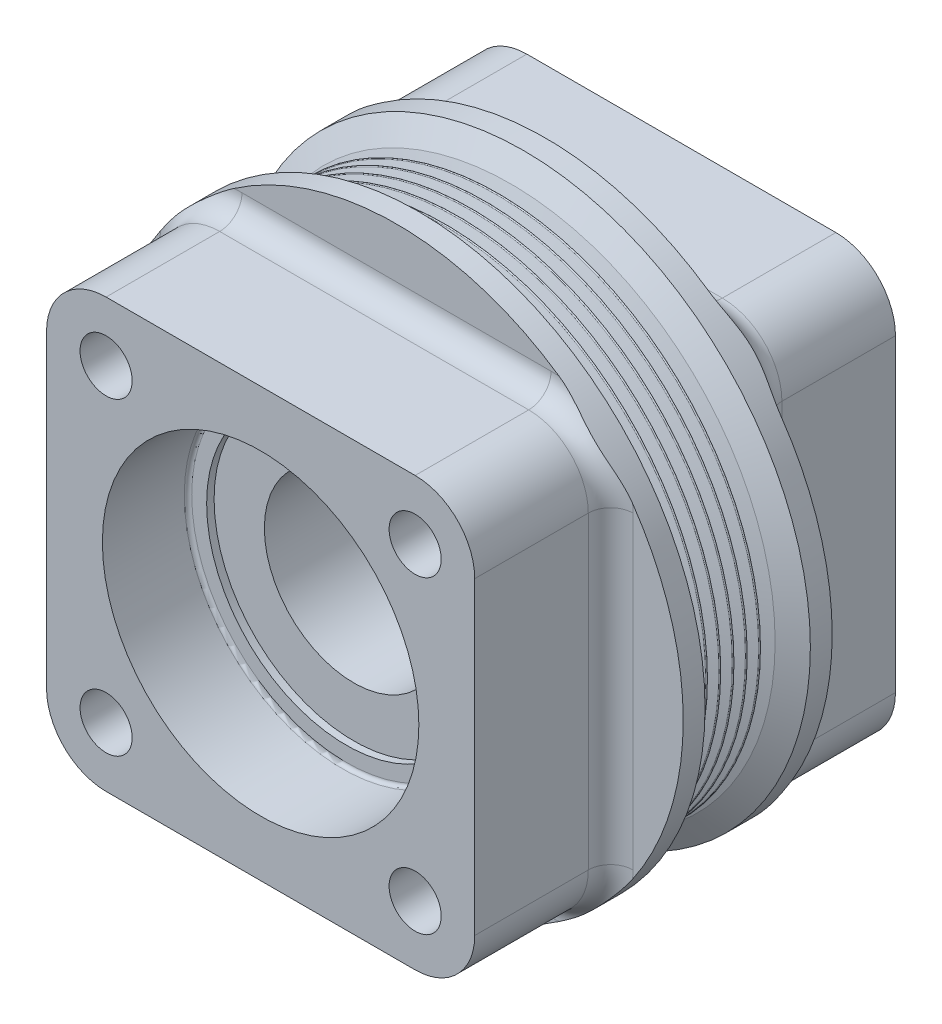
from build123d import *

# Parameters (mm, degrees)
EXTRUS_O_QUADRADO_DEPTH       = 56.5
FURO_EIXO_PASSANTE_DEPTH      = 123.6794605090844
FURO_EIXO_PASSANTE_DEPTH_BACK = 123.6794605090844
ESBO_O4_5_R                   = 24
REBAIXO_START                 = -56.5
ESBO_O4_R                     = 42.5
REBAIXO_ROLAMENTO_1_DEPTH     = 23
REBAIXO_START_2               = 33.5
ESBO_O4_4_R                   = 42.5
REBAIXO_ROLAMENTO_2_DEPTH     = 23
CORTE_EXTRUS_O4_START         = 33.5
ESBO_O4_6_R                   = 37.50000000000001
CORTE_EXTRUS_O4_DEPTH         = 2
CORTE_EXTRUS_O5_START         = -31.5
ESBO_O4_7_R                   = 37.50000000000001
CORTE_EXTRUS_O5_DEPTH         = 2
FUROS_FIXA_O_1_D              = 14
FUROS_FIXA_O_1_DEPTH          = 30
FUROS_FIXA_O_1_TIP            = 4.206024333192922
FUROS_FIXA_O_2_D              = 14
FUROS_FIXA_O_2_DEPTH          = 30
FUROS_FIXA_O_2_TIP            = 4.206024333192922
FILETE_AL_VIO_R               = 6
FILETE4_R                     = 1


# Read off the part's stored shape, not the designer's step: CORTE REVOLUÇÃO POLIA
with BuildPart() as part:
    # Esboço2 → EXTRUSÃO QUADRADO (new, symmetric)
    with BuildSketch(Plane.XY):
        with BuildLine():
            Line((-41.49999999999999, -57.5), (41.50000000000001, -57.5))
            ThreePointArc((41.50000000000001, -57.5), (52.81370849898477, -52.81370849898476), (57.5, -41.5))
            Line((57.5, -41.5), (57.50000000000001, 41.500000000000014))
            ThreePointArc((57.50000000000001, 41.500000000000014), (52.813708498984774, 52.81370849898478), (41.50000000000001, 57.500000000000014))
            Line((41.50000000000001, 57.500000000000014), (-41.49999999999999, 57.500000000000014))
            ThreePointArc((-41.49999999999999, 57.500000000000014), (-52.81370849898475, 52.813708498984774), (-57.49999999999999, 41.500000000000014))
            Line((-57.49999999999999, 41.500000000000014), (-57.49999999999999, -41.5))
            ThreePointArc((-57.49999999999999, -41.5), (-52.81370849898475, -52.81370849898476), (-41.49999999999999, -57.5))
        make_face()
    extrude(amount=EXTRUS_O_QUADRADO_DEPTH, both=True)

    # Esboço3 → REVOLUÇÃO POLIA (revolve)
    with BuildSketch(Plane(origin=(0, 0, 0), x_dir=(0, 0, -1), z_dir=(1, 0, 0)), mode=Mode.PRIVATE) as revolu_o_polia_sk:
        with BuildLine():
            Line((-7.354923155196484, 70.35455393579063), (-8.430153689607168, 67.40038232178915))
            ThreePointArc((-8.430153689607168, 67.40038232178915), (-8.900000000000023, 67.07139239345206), (-9.369846310392886, 67.40038232178915))
            Line((-9.369846310392886, 67.40038232178915), (-10.679999999999998, 71))
            Line((-10.679999999999998, 71), (-14.144101615137766, 77))
            Line((-14.144101615137766, 77), (-20.000000000000004, 77))
            Line((-20.000000000000004, 77), (-20, 0))
            Line((-20, 0), (20, 0))
            Line((20, 0), (20.000000000000004, 77))
            Line((20.000000000000004, 77), (14.144101615137759, 77))
            Line((14.144101615137759, 77), (10.679999999999998, 71))
            Line((10.679999999999998, 71), (9.369846310392832, 67.40038232178915))
            ThreePointArc((9.369846310392832, 67.40038232178915), (8.89999999999998, 67.07139239345206), (8.43015368960713, 67.40038232178915))
            Line((8.43015368960713, 67.40038232178915), (7.354923155196457, 70.35455393579065))
            ThreePointArc((7.354923155196457, 70.35455393579065), (7.119999999999998, 70.51904889995923), (6.885076844803523, 70.35455393579066))
            Line((6.885076844803523, 70.35455393579066), (5.809846310392832, 67.40038232178917))
            ThreePointArc((5.809846310392832, 67.40038232178917), (5.339999999999984, 67.07139239345206), (4.8701536896071085, 67.40038232178915))
            Line((4.8701536896071085, 67.40038232178915), (3.7949231551964493, 70.35455393579062))
            ThreePointArc((3.7949231551964493, 70.35455393579062), (3.559999999999979, 70.51904889995919), (3.325076844803502, 70.35455393579062))
            Line((3.325076844803502, 70.35455393579062), (2.249846310392827, 67.40038232178917))
            ThreePointArc((2.249846310392827, 67.40038232178917), (1.7799999999999798, 67.07139239345207), (1.310153689607125, 67.40038232178917))
            Line((1.310153689607125, 67.40038232178917), (0.23492315519646462, 70.35455393579063))
            ThreePointArc((0.23492315519646462, 70.35455393579063), (3.83e-15, 70.51904889995922), (-0.23492315519647558, 70.35455393579065))
            Line((-0.23492315519647558, 70.35455393579065), (-1.3101536896071617, 67.40038232178917))
            ThreePointArc((-1.3101536896071617, 67.40038232178917), (-1.7800000000000142, 67.07139239345206), (-2.2498463103928654, 67.40038232178917))
            Line((-2.2498463103928654, 67.40038232178917), (-3.325076844803528, 70.35455393579063))
            ThreePointArc((-3.325076844803528, 70.35455393579063), (-3.560000000000005, 70.51904889995922), (-3.7949231551964853, 70.35455393579063))
            Line((-3.7949231551964853, 70.35455393579063), (-4.870153689607166, 67.40038232178915))
            ThreePointArc((-4.870153689607166, 67.40038232178915), (-5.340000000000018, 67.07139239345206), (-5.809846310392879, 67.40038232178915))
            Line((-5.809846310392879, 67.40038232178915), (-6.885076844803537, 70.35455393579062))
            ThreePointArc((-6.885076844803537, 70.35455393579062), (-7.12, 70.5190488999592), (-7.354923155196484, 70.35455393579063))
        make_face()
    revolve(revolu_o_polia_sk.sketch.rotate(Axis((0, 0, 20), (0, 0, -1)), 90), axis=Axis((0, 0, 20), (0, 0, -1)))

    # CORTE REVOLUÇÃO POLIA outline → CORTE REVOLUÇÃO POLIA (revolve, cut)
    with BuildSketch(Plane.XZ):
        with BuildLine():
            Line((77, 14.144101615), (71, 10.68))
            Line((71, 10.68), (67.400382322, 9.36984631))
            ThreePointArc((67.400382322, 9.36984631), (67.071392393, 8.9), (67.400382322, 8.43015369))
            Line((67.400382322, 8.43015369), (70.354553936, 7.354923155))
            ThreePointArc((70.354553936, 7.354923155), (70.5190489, 7.12), (70.354553936, 6.885076845))
            Line((70.354553936, 6.885076845), (67.400382322, 5.80984631))
            ThreePointArc((67.400382322, 5.80984631), (67.071392393, 5.34), (67.400382322, 4.87015369))
            Line((67.400382322, 4.87015369), (70.354553936, 3.794923155))
            ThreePointArc((70.354553936, 3.794923155), (70.5190489, 3.56), (70.354553936, 3.325076845))
            Line((70.354553936, 3.325076845), (67.400382322, 2.24984631))
            ThreePointArc((67.400382322, 2.24984631), (67.071392393, 1.78), (67.400382322, 1.31015369))
            Line((67.400382322, 1.31015369), (70.354553936, 0.234923155))
            ThreePointArc((70.354553936, 0.234923155), (70.5190489, 0), (70.354553936, -0.234923155))
            Line((70.354553936, -0.234923155), (67.400382322, -1.31015369))
            ThreePointArc((67.400382322, -1.31015369), (67.071392393, -1.78), (67.400382322, -2.24984631))
            Line((67.400382322, -2.24984631), (70.354553936, -3.325076845))
            ThreePointArc((70.354553936, -3.325076845), (70.5190489, -3.56), (70.354553936, -3.794923155))
            Line((70.354553936, -3.794923155), (67.400382322, -4.87015369))
            ThreePointArc((67.400382322, -4.87015369), (67.071392393, -5.34), (67.400382322, -5.80984631))
            Line((67.400382322, -5.80984631), (70.354553936, -6.885076845))
            ThreePointArc((70.354553936, -6.885076845), (70.5190489, -7.12), (70.354553936, -7.354923155))
            Line((70.354553936, -7.354923155), (67.400382322, -8.43015369))
            ThreePointArc((67.400382322, -8.43015369), (67.071392393, -8.9), (67.400382322, -9.36984631))
            Line((67.400382322, -9.36984631), (71, -10.68))
            Line((71, -10.68), (77, -14.144101615))
            Line((77, -14.144101615), (77, 14.144101615))
        make_face()
    revolve(axis=Axis((0, 0, 0), (0, 0, 1)), mode=Mode.SUBTRACT)

    # Esboço4<5> → FURO EIXO PASSANTE (cut, two sides: drawn at the far end of the back side and taken through both)
    with BuildSketch(Plane.XY.offset(-FURO_EIXO_PASSANTE_DEPTH_BACK)):
        Circle(ESBO_O4_5_R)
    extrude(amount=FURO_EIXO_PASSANTE_DEPTH + FURO_EIXO_PASSANTE_DEPTH_BACK, mode=Mode.SUBTRACT)

    # Esboço4 → REBAIXO ROLAMENTO 1 (cut)
    with BuildSketch(Plane.XY.offset(REBAIXO_START)):
        with Locations(Location((0, 0, 0), (0, 0, 180))):
            Circle(ESBO_O4_R)
    extrude(amount=REBAIXO_ROLAMENTO_1_DEPTH, mode=Mode.SUBTRACT)

    # Esboço4<4> → REBAIXO ROLAMENTO 2 (cut)
    with BuildSketch(Plane.XY.offset(REBAIXO_START_2)):
        with Locations(Location((0, 0, 0), (0, 0, 180))):
            Circle(ESBO_O4_4_R)
    extrude(amount=REBAIXO_ROLAMENTO_2_DEPTH, mode=Mode.SUBTRACT)

    # Esboço4<6> → Corte-extrusão4 (cut)
    with BuildSketch(Plane.XY.offset(CORTE_EXTRUS_O4_START)):
        with Locations(Location((0, 0, 0), (0, 0, 180))):
            Circle(ESBO_O4_6_R)
    extrude(amount=-CORTE_EXTRUS_O4_DEPTH, mode=Mode.SUBTRACT)

    # Esboço4<7> → Corte-extrusão5 (cut)
    with BuildSketch(Plane.XY.offset(CORTE_EXTRUS_O5_START)):
        with Locations(Location((0, 0, 0), (0, 0, 180))):
            Circle(ESBO_O4_7_R)
    extrude(amount=-CORTE_EXTRUS_O5_DEPTH, mode=Mode.SUBTRACT)

    # FUROS FIXAÇÃO 1
    with Locations(Plane(origin=(0, 0, -56.5), x_dir=(-1, 0, 0), z_dir=(0, 0, -1))):
        with Locations((41.5, 41.5), (-41.5, -41.5), (-41.5, 41.5), (41.5, -41.5)):
            Hole(FUROS_FIXA_O_1_D / 2, depth=FUROS_FIXA_O_1_DEPTH)
            with Locations((0, 0, -(FUROS_FIXA_O_1_DEPTH + FUROS_FIXA_O_1_TIP / 2))):  # 118° drill point
                Cone(0, FUROS_FIXA_O_1_D / 2, FUROS_FIXA_O_1_TIP, mode=Mode.SUBTRACT)

    # FUROS FIXAÇÃO 2
    with Locations(Plane.XY.offset(56.5)):
        with Locations((-41.5, 41.5), (41.5, 41.5), (41.5, -41.5), (-41.5, -41.5)):
            Hole(FUROS_FIXA_O_2_D / 2, depth=FUROS_FIXA_O_2_DEPTH)
            with Locations((0, 0, -(FUROS_FIXA_O_2_DEPTH + FUROS_FIXA_O_2_TIP / 2))):  # 118° drill point
                Cone(0, FUROS_FIXA_O_2_D / 2, FUROS_FIXA_O_2_TIP, mode=Mode.SUBTRACT)

    # FILETE ALÍVIO
    # the kernel refuses this fillet: 6 mm, written as the material it adds along each edge
    with BuildSketch(Plane(origin=(-41.499999999999986, 41.500000000000014, 20.000000000000004), x_dir=(-4.4e-16, 1, 0), z_dir=(1, 4.4e-16, 0))) as filete_al_vio_piece_1_section:
        with BuildLine():
            CenterArc((16 + FILETE_AL_VIO_R, FILETE_AL_VIO_R), FILETE_AL_VIO_R, 180, 90)
            Line((16 + FILETE_AL_VIO_R, 0), (16, 0))
            Line((16, 0), (16, FILETE_AL_VIO_R))
        make_face()
    filete_al_vio_piece_1 = revolve(axis=Axis((-41.499999999999986, 41.500000000000014, 20.000000000000004), (0, 0, 1)), revolution_arc=89.99999999999997, mode=Mode.PRIVATE)
    filete_al_vio_piece_1 = filete_al_vio_piece_1 & Plane(origin=(0, 0, 21.714468670196165), x_dir=(1, 1.1e-16, 0), z_dir=(0, 0, 1)) * Cylinder(77, 88, mode=Mode.PRIVATE)
    add(filete_al_vio_piece_1)
    with BuildSketch(Plane(origin=(-57.49999999999999, 41.500000000000014, 20.000000000000004), x_dir=(0, 0, 1), z_dir=(0, -1, 0)), Plane(origin=(-57.49999999999999, -41.5, -20), x_dir=(0, 0, -1), z_dir=(0, 1, 0)), Plane(origin=(57.5, -41.5, 20.000000000000004), x_dir=(0, 0, 1), z_dir=(9e-17, 1, 0))) as filete_al_vio_piece_2:
        with BuildLine():
            CenterArc((FILETE_AL_VIO_R, FILETE_AL_VIO_R), FILETE_AL_VIO_R, 180, 90)
            Line((0, FILETE_AL_VIO_R), (0, 0))
            Line((0, 0), (FILETE_AL_VIO_R, 0))
        make_face()
    extrude(amount=83.00000000000001)
    with BuildSketch(Plane(origin=(-41.499999999999986, -41.5, 20.000000000000004), x_dir=(-1, 0, 0), z_dir=(0, 1, 0))) as filete_al_vio_piece_3_section:
        with BuildLine():
            CenterArc((16 + FILETE_AL_VIO_R, FILETE_AL_VIO_R), FILETE_AL_VIO_R, 180, 90)
            Line((16 + FILETE_AL_VIO_R, 0), (16, 0))
            Line((16, 0), (16, FILETE_AL_VIO_R))
        make_face()
    filete_al_vio_piece_3 = revolve(axis=Axis((-41.499999999999986, -41.5, 20.000000000000004), (0, 0, 1)), revolution_arc=89.99999999999997, mode=Mode.PRIVATE)
    filete_al_vio_piece_3 = filete_al_vio_piece_3 & Plane(origin=(0, 0, 21.714468670196165), x_dir=(1, 1.1e-16, 0), z_dir=(0, 0, 1)) * Cylinder(77, 88, mode=Mode.PRIVATE)
    add(filete_al_vio_piece_3)
    with BuildSketch(Plane(origin=(41.50000000000003, 41.500000000000036, 20.000000000000004), x_dir=(1, -1.33e-15, 0), z_dir=(-1.33e-15, -1, 0))) as filete_al_vio_piece_4_section:
        with BuildLine():
            CenterArc((15.999999999999979 + FILETE_AL_VIO_R, FILETE_AL_VIO_R), FILETE_AL_VIO_R, 180, 90)
            Line((15.999999999999979 + FILETE_AL_VIO_R, 0), (15.999999999999979, 0))
            Line((15.999999999999979, 0), (15.999999999999979, FILETE_AL_VIO_R))
        make_face()
    filete_al_vio_piece_4 = revolve(axis=Axis((41.50000000000003, 41.500000000000036, 20.000000000000004), (0, 0, 1)), revolution_arc=90.00000000000016, mode=Mode.PRIVATE)
    filete_al_vio_piece_4 = filete_al_vio_piece_4 & Plane(origin=(0, 0, 21.71446867019617), x_dir=(1, 1.1e-16, 0), z_dir=(0, 0, 1)) * Cylinder(77, 88, mode=Mode.PRIVATE)
    add(filete_al_vio_piece_4)
    with BuildSketch(Plane(origin=(-41.499999999999986, 41.500000000000014, -20), x_dir=(-4.4e-16, 1, 0), z_dir=(1, 4.4e-16, 0))) as filete_al_vio_piece_5_section:
        with BuildLine():
            CenterArc((16 + FILETE_AL_VIO_R, -FILETE_AL_VIO_R), FILETE_AL_VIO_R, 90, 90)
            Line((16, -FILETE_AL_VIO_R), (16, 0))
            Line((16, 0), (16 + FILETE_AL_VIO_R, 0))
        make_face()
    filete_al_vio_piece_5 = revolve(axis=Axis((-41.499999999999986, 41.500000000000014, -20), (0, 0, 1)), revolution_arc=89.99999999999997, mode=Mode.PRIVATE)
    filete_al_vio_piece_5 = filete_al_vio_piece_5 & Plane(origin=(0, 0, -21.714468670219873), x_dir=(1, 1.1e-16, 0), z_dir=(0, 0, 1)) * Cylinder(77, 88, mode=Mode.PRIVATE)
    add(filete_al_vio_piece_5)
    with BuildSketch(Plane(origin=(41.50000000000003, 41.500000000000036, -20), x_dir=(1, -1.33e-15, 0), z_dir=(-1.33e-15, -1, 0))) as filete_al_vio_piece_6_section:
        with BuildLine():
            CenterArc((15.999999999999979 + FILETE_AL_VIO_R, -FILETE_AL_VIO_R), FILETE_AL_VIO_R, 90, 90)
            Line((15.999999999999979, -FILETE_AL_VIO_R), (15.999999999999979, 0))
            Line((15.999999999999979, 0), (15.999999999999979 + FILETE_AL_VIO_R, 0))
        make_face()
    filete_al_vio_piece_6 = revolve(axis=Axis((41.50000000000003, 41.500000000000036, -20), (0, 0, 1)), revolution_arc=90.00000000000016, mode=Mode.PRIVATE)
    filete_al_vio_piece_6 = filete_al_vio_piece_6 & Plane(origin=(0, 0, -21.714468670219873), x_dir=(1, 1.1e-16, 0), z_dir=(0, 0, 1)) * Cylinder(77, 88, mode=Mode.PRIVATE)
    add(filete_al_vio_piece_6)
    with BuildSketch(Plane(origin=(-41.499999999999986, -41.5, -20), x_dir=(-1, 0, 0), z_dir=(0, 1, 0))) as filete_al_vio_piece_7_section:
        with BuildLine():
            CenterArc((16 + FILETE_AL_VIO_R, -FILETE_AL_VIO_R), FILETE_AL_VIO_R, 90, 90)
            Line((16 + FILETE_AL_VIO_R, 0), (16, 0))
            Line((16, 0), (16, -FILETE_AL_VIO_R))
        make_face()
    filete_al_vio_piece_7 = revolve(axis=Axis((-41.499999999999986, -41.5, -20), (0, 0, 1)), revolution_arc=89.99999999999997, mode=Mode.PRIVATE)
    filete_al_vio_piece_7 = filete_al_vio_piece_7 & Plane(origin=(0, 0, -21.714468670196162), x_dir=(1, 1.1e-16, 0), z_dir=(0, 0, 1)) * Cylinder(77, 88, mode=Mode.PRIVATE)
    add(filete_al_vio_piece_7)
    with BuildSketch(Plane(origin=(41.5, -41.50000000000001, 20.000000000000004), x_dir=(4.4e-16, -1, 0), z_dir=(-1, -4.4e-16, 0))) as filete_al_vio_piece_8_section:
        with BuildLine():
            CenterArc((16 + FILETE_AL_VIO_R, FILETE_AL_VIO_R), FILETE_AL_VIO_R, 180, 90)
            Line((16 + FILETE_AL_VIO_R, 0), (16, 0))
            Line((16, 0), (16, FILETE_AL_VIO_R))
        make_face()
    filete_al_vio_piece_8 = revolve(axis=Axis((41.5, -41.50000000000001, 20.000000000000004), (0, 0, 1)), revolution_arc=90, mode=Mode.PRIVATE)
    filete_al_vio_piece_8 = filete_al_vio_piece_8 & Plane(origin=(0, 0, 21.714468670196165), x_dir=(1, 1.1e-16, 0), z_dir=(0, 0, 1)) * Cylinder(77, 88, mode=Mode.PRIVATE)
    add(filete_al_vio_piece_8)
    with BuildSketch(Plane(origin=(-41.49999999999999, -57.5, 20.000000000000004), x_dir=(0, 0, 1), z_dir=(1, 0, 0)), Plane(origin=(41.50000000000001, 57.500000000000014, 20.000000000000004), x_dir=(0, 0, 1), z_dir=(-1, 0, 0))) as filete_al_vio_piece_9:
        with BuildLine():
            CenterArc((FILETE_AL_VIO_R, FILETE_AL_VIO_R), FILETE_AL_VIO_R, 180, 90)
            Line((0, FILETE_AL_VIO_R), (0, 0))
            Line((0, 0), (FILETE_AL_VIO_R, 0))
        make_face()
    extrude(amount=83)
    with BuildSketch(Plane(origin=(41.5, -57.5, -20), x_dir=(0, -1, 0), z_dir=(-1, 0, 0)), Plane(origin=(-41.5, 57.500000000000014, -20), x_dir=(0, 1, 0), z_dir=(1, 0, 0))) as filete_al_vio_piece_10:
        with BuildLine():
            CenterArc((FILETE_AL_VIO_R, -FILETE_AL_VIO_R), FILETE_AL_VIO_R, 90, 90)
            Line((0, -FILETE_AL_VIO_R), (0, 0))
            Line((0, 0), (FILETE_AL_VIO_R, 0))
        make_face()
    extrude(amount=83)
    with BuildSketch(Plane(origin=(41.5, -41.50000000000001, -20), x_dir=(4.4e-16, -1, 0), z_dir=(-1, -4.4e-16, 0))) as filete_al_vio_piece_11_section:
        with BuildLine():
            CenterArc((16 + FILETE_AL_VIO_R, -FILETE_AL_VIO_R), FILETE_AL_VIO_R, 90, 90)
            Line((16, -FILETE_AL_VIO_R), (16, 0))
            Line((16, 0), (16 + FILETE_AL_VIO_R, 0))
        make_face()
    filete_al_vio_piece_11 = revolve(axis=Axis((41.5, -41.50000000000001, -20), (0, 0, 1)), revolution_arc=90, mode=Mode.PRIVATE)
    filete_al_vio_piece_11 = filete_al_vio_piece_11 & Plane(origin=(0, 0, -21.714468670219873), x_dir=(1, 1.1e-16, 0), z_dir=(0, 0, 1)) * Cylinder(77, 88, mode=Mode.PRIVATE)
    add(filete_al_vio_piece_11)
    with BuildSketch(Plane(origin=(57.50000000000001, 41.500000000000014, -20), x_dir=(1, -9e-17, 0), z_dir=(-9e-17, -1, 0))) as filete_al_vio_piece_12:
        with BuildLine():
            CenterArc((FILETE_AL_VIO_R, -FILETE_AL_VIO_R), FILETE_AL_VIO_R, 90, 90)
            Line((0, -FILETE_AL_VIO_R), (0, 0))
            Line((0, 0), (FILETE_AL_VIO_R, 0))
        make_face()
    extrude(amount=83.00000000000001)

    # Filete4
    filete4_edges = [part.edges().sort_by_distance(p)[0] for p in [
        (42.5, -1.041e-14, -33.5),
        (42.5, -1.041e-14, 33.5),
    ]]
    fillet(filete4_edges, radius=FILETE4_R)


solid = part.part
